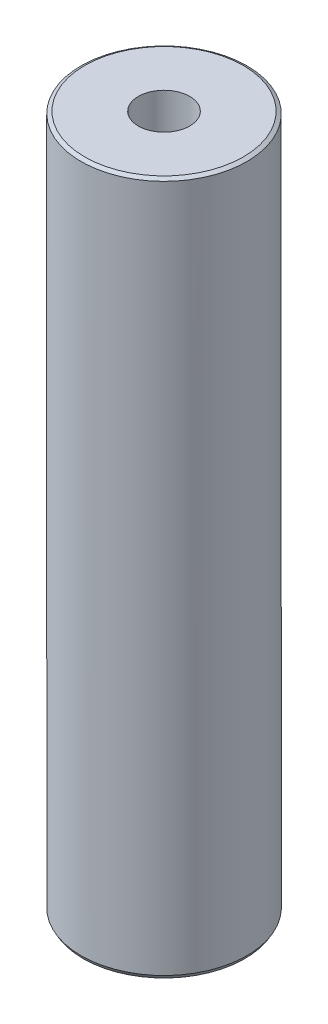
from build123d import *
from OCP.BRepFilletAPI import BRepFilletAPI_MakeChamfer

# Parameters (mm, degrees)
SKETCH1_R           = 30
BOSS_EXTRUDE1_DEPTH = 250.842656027
SKETCH2_R           = 9.293038811
CUT_EXTRUDE1_DEPTH  = 255.405263473
CHAMFER1_SIZE       = 0.767313646
CHAMFER1_SIZE2      = 1.329026221


with BuildPart() as part:
    # Sketch1 → Boss-Extrude1 (new body)
    with BuildSketch(Plane(origin=(0, 0, 0), x_dir=(1, 0, 0), z_dir=(0, 1, 0))):
        Circle(SKETCH1_R)
    extrude(amount=BOSS_EXTRUDE1_DEPTH)

    # Sketch2 → Cut-Extrude1 (cut, through all)
    with BuildSketch(Plane(origin=(0, 0, 0), x_dir=(1, 0, 0), z_dir=(0, 1, 0))):
        Circle(SKETCH2_R)
    extrude(amount=CUT_EXTRUDE1_DEPTH, mode=Mode.SUBTRACT)

    # Chamfer1: one chamfer whose edges measure the first distance from different faces: ONE call of the kernel's chamfer builder (chamfer() names one face for all edges)
    chamfer1_edges_1 = [part.edges().sort_by_distance(p)[0] for p in [
        (-30, 250.842656027, 0),
    ]]
    chamfer1_side_1 = [part.faces().sort_by_distance(p)[0] for p in [
        (-30, 125.421328014, 0),
    ]]
    chamfer1_edges_2 = [part.edges().sort_by_distance(p)[0] for p in [
        (-30, 0, 0),
    ]]
    chamfer1_side_2 = [part.faces().sort_by_distance(p)[0] for p in [
        (-29.151471863, 0, 0),
    ]]
    chamfer1 = BRepFilletAPI_MakeChamfer(part.part.solid().wrapped)
    for e in chamfer1_edges_1:
        chamfer1.Add(CHAMFER1_SIZE, CHAMFER1_SIZE2, e.wrapped, chamfer1_side_1[0].wrapped)  # the first distance lies on this face
    for e in chamfer1_edges_2:
        chamfer1.Add(CHAMFER1_SIZE, CHAMFER1_SIZE2, e.wrapped, chamfer1_side_2[0].wrapped)  # the first distance lies on this face
    add(Compound.cast(chamfer1.Shape()), mode=Mode.REPLACE)


solid = part.part
